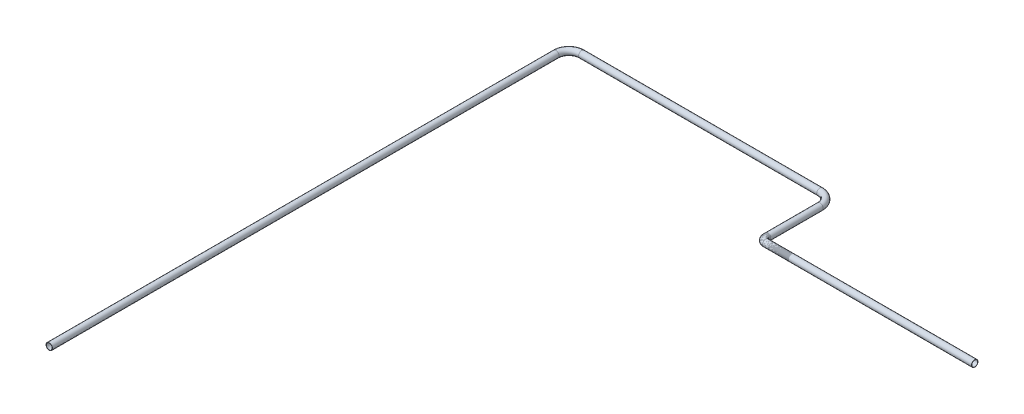
from build123d import *

# Parameters (mm, degrees)
SKETCH14_R   = 38.1
SKETCH14_R_2 = 34.925
SKETCH16_R   = 38.1
SKETCH16_R_2 = 34.925
SKETCH18_R   = 38.1
SKETCH18_R_2 = 34.925


with BuildPart() as part:
    # Sweep1: sweep along a path in Sketch13
    with BuildLine(Plane(origin=(0, 0, 0), x_dir=(1, 0, 0), z_dir=(0, 1, 0))) as sweep1_path:
        Line((-3098.8, -6096), (-3098.8, -152.4))
        ThreePointArc((-3098.8, -152.4), (-3054.163073453, -44.636926547), (-2946.4, 0))
        Line((-2946.4, 0), (-152.4, 0))
        ThreePointArc((-152.4, 0), (-44.636926547, -44.636926547), (0, -152.4))
        Line((0, -152.4), (0, -762))
    # Sketch14 → Sweep1 (sweep)
    with BuildSketch(Plane.XY.offset(762)):
        Circle(SKETCH14_R)
        Circle(SKETCH14_R_2, mode=Mode.SUBTRACT)
    sweep(path=sweep1_path.line)

    # Sweep2: sweep along a path in Sketch15
    with BuildLine(Plane(origin=(0, 0, 0), x_dir=(1, 0, 0), z_dir=(0, 1, 0))) as sweep2_path:
        Line((0, -762), (0, -787.4))
        ThreePointArc((0, -787.4), (14.878975516, -823.321024484), (50.8, -838.2))
        Line((50.8, -838.2), (2501.9, -838.2))
    # Sketch16 → Sweep2 (sweep)
    with BuildSketch(Plane.XY.offset(762)):
        Circle(SKETCH16_R)
        Circle(SKETCH16_R_2, mode=Mode.SUBTRACT)
    sweep(path=sweep2_path.line)


with BuildPart() as body_2:
    # Sweep3: sweep along a path in Sketch17
    with BuildLine(Plane(origin=(0, 0, 0), x_dir=(1, 0, 0), z_dir=(0, 1, 0))) as sweep3_path:
        Line((0, -762), (0, -787.4))
        ThreePointArc((0, -787.4), (14.878975516, -823.321024484), (50.8, -838.2))
        Line((50.8, -838.2), (355.6, -838.2))
    # Sketch18 → Sweep3 (sweep)
    with BuildSketch(Plane.XY.offset(762)):
        Circle(SKETCH18_R)
        Circle(SKETCH18_R_2, mode=Mode.SUBTRACT)
    sweep(path=sweep3_path.line)


solid = Compound([part.part, body_2.part])
